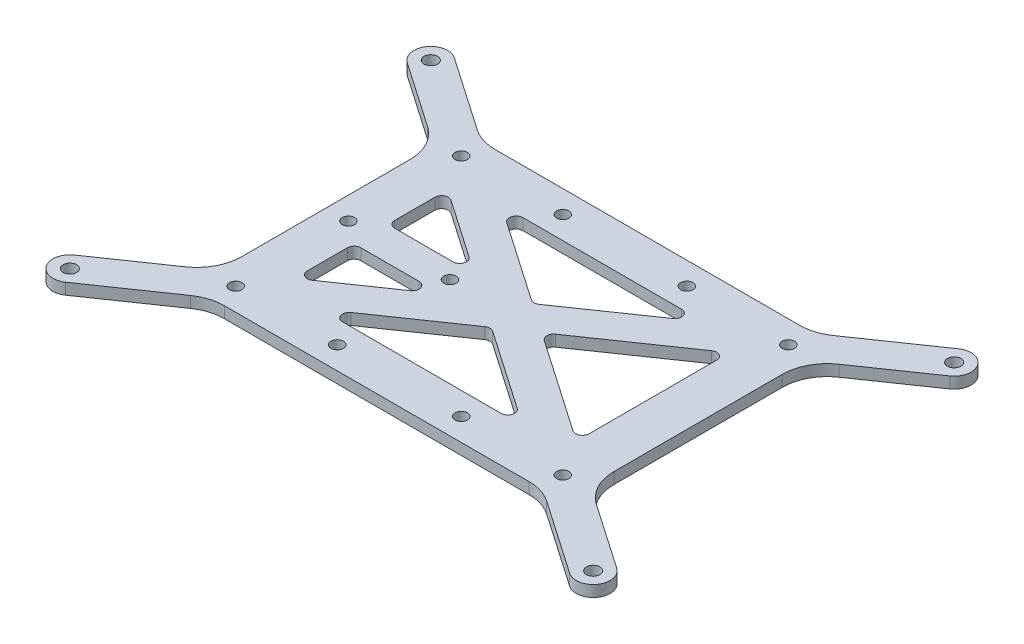
from build123d import *

# Parameters (mm, degrees)
BASE_FLANGE1_START     = -5
BASE_FLANGE1_OUTLINE_W = 165
BASE_FLANGE1_OUTLINE_H = 120
BASE_FLANGE1_DEPTH     = 5
SKETCH2_R              = 2.75
CUT_EXTRUDE1_DEPTH     = 5
CUT_EXTRUDE2_DEPTH     = 5
FILLET2_R              = 3
SKETCH4_R              = 3
TAB1_DEPTH             = 5
FILLET3_R              = 20


# Read off the part's stored shape, not the designer's step: Base-Flange1
# Sheet-metal steps are written as plain solids
with BuildPart() as part:
    # Base-Flange1 outline → Base-Flange1 (new body)
    with BuildSketch(Plane(origin=(0, 0, 0), x_dir=(1, 0, 0), z_dir=(0, 1, 0)).offset(BASE_FLANGE1_START)):
        Rectangle(BASE_FLANGE1_OUTLINE_W, BASE_FLANGE1_OUTLINE_H)
    extrude(amount=BASE_FLANGE1_DEPTH)

    # Sketch2 → Cut-Extrude1 (cut)
    with BuildSketch(Plane(origin=(0, 0, 0), x_dir=(1, 0, 0), z_dir=(0, 1, 0))):
        with Locations(Location((-72.5, 50, 0), (0, 0, 270))):
            Circle(SKETCH2_R)
        with Locations(Location((-72.5, 0, 0), (0, 0, 270))):
            Circle(SKETCH2_R)
        with Locations(Location((-72.5, -50, 0), (0, 0, 270))):
            Circle(SKETCH2_R)
        with Locations(Location((-27.5, -50, 0), (0, 0, 90))):
            Circle(SKETCH2_R)
        with Locations(Location((-27.5, 0, 0), (0, 0, 90))):
            Circle(SKETCH2_R)
        with Locations(Location((-27.5, 50, 0), (0, 0, 90))):
            Circle(SKETCH2_R)
        with Locations(Location((27.5, -50, 0), (0, 0, 270))):
            Circle(SKETCH2_R)
        with Locations(Location((72.5, -50, 0), (0, 0, 90))):
            Circle(SKETCH2_R)
        with Locations(Location((27.5, 50, 0), (0, 0, 270))):
            Circle(SKETCH2_R)
        with Locations(Location((72.5, 50, 0), (0, 0, 90))):
            Circle(SKETCH2_R)
    extrude(amount=-CUT_EXTRUDE1_DEPTH, mode=Mode.SUBTRACT)

    # Sketch3 → Cut-Extrude2 (cut)
    with BuildSketch(Plane(origin=(0, 0, 0), x_dir=(1, 0, 0), z_dir=(0, 1, 0))):
        Polygon((-62.5, -7.5), (-62.5, -33.99280261), (-24.085436215, -7.5), align=None)
        Polygon((-62.5, 7.5), (-24.085436215, 7.5), (-62.5, 33.99280261), align=None)
        Polygon((-44.789563785, 40), (0, 9.110645666), (44.789563785, 40), align=None)
        Polygon((62.5, 33.99280261), (13.210436215, 0), (62.5, -33.99280261), align=None)
        Polygon((-44.789563785, -40), (44.789563785, -40), (0, -9.110645666), align=None)
    extrude(amount=-CUT_EXTRUDE2_DEPTH, mode=Mode.SUBTRACT)

    # Fillet2
    fillet2_edges = [part.edges().sort_by_distance(p)[0] for p in [
        (13.210436215, -2.5, 0),
        (62.5, -2.5, -33.99280261),
        (62.5, -2.5, 33.99280261),
        (44.789563785, -2.5, 40),
        (-44.789563785, -2.5, 40),
        (0, -2.5, 9.110645666),
        (-62.5, -2.5, 33.99280261),
        (-62.5, -2.5, 7.5),
        (-24.085436215, -2.5, 7.5),
        (-24.085436215, -2.5, -7.5),
        (-62.5, -2.5, -7.5),
        (-62.5, -2.5, -33.99280261),
        (0, -2.5, -9.110645666),
        (-44.789563785, -2.5, -40),
        (44.789563785, -2.5, -40),
    ]]
    fillet(fillet2_edges, radius=FILLET2_R)

    # Sketch4 → Tab1 (add)
    # profile 1 of 4: a face of its own
    with BuildSketch(Plane(origin=(0, 0, 0), x_dir=(1, 0, 0), z_dir=(0, 1, 0))):
        with BuildLine():
            Line((-73.789563785, 60), (-111.742002831, 86.174095894))
            ThreePointArc((-111.742002831, 86.174095894), (-122.174095894, 84.257997169), (-120.257997169, 73.825904106))
            Line((-120.257997169, 73.825904106), (-82.5, 47.785906058))
            Line((-82.5, 47.785906058), (-73.789563785, 60))
        make_face()
        with Locations(Location((-116, 80, 0), (0, 0, 270))):
            Circle(SKETCH4_R, mode=Mode.SUBTRACT)
    # profile 2 of 4: a face of its own
    with BuildSketch(Plane(origin=(0, 0, 0), x_dir=(1, 0, 0), z_dir=(0, 1, 0))):
        with BuildLine():
            Line((73.789563785, 60), (82.5, 47.785906058))
            Line((82.5, 47.785906058), (120.257997169, 73.825904106))
            ThreePointArc((120.257997169, 73.825904106), (122.174095894, 84.257997169), (111.742002831, 86.174095894))
            Line((111.742002831, 86.174095894), (73.789563785, 60))
        make_face()
        with Locations(Location((116, 80, 0), (0, 0, 90))):
            Circle(SKETCH4_R, mode=Mode.SUBTRACT)
    # profile 3 of 4: a face of its own
    with BuildSketch(Plane(origin=(0, 0, 0), x_dir=(1, 0, 0), z_dir=(0, 1, 0))):
        with BuildLine():
            Line((73.789563785, -60), (111.742002831, -86.174095894))
            ThreePointArc((111.742002831, -86.174095894), (122.174095894, -84.257997169), (120.257997169, -73.825904106))
            Line((120.257997169, -73.825904106), (82.5, -47.785906058))
            Line((82.5, -47.785906058), (73.789563785, -60))
        make_face()
        with Locations(Location((116, -80, 0), (0, 0, 270))):
            Circle(SKETCH4_R, mode=Mode.SUBTRACT)
    # profile 4 of 4: a face of its own
    with BuildSketch(Plane(origin=(0, 0, 0), x_dir=(1, 0, 0), z_dir=(0, 1, 0))):
        with BuildLine():
            Line((-73.789563785, -60), (-82.5, -47.785906058))
            Line((-82.5, -47.785906058), (-120.257997169, -73.825904106))
            ThreePointArc((-120.257997169, -73.825904106), (-122.174095894, -84.257997169), (-111.742002831, -86.174095894))
            Line((-111.742002831, -86.174095894), (-73.789563785, -60))
        make_face()
        with Locations(Location((-116, -80, 0), (0, 0, 90))):
            Circle(SKETCH4_R, mode=Mode.SUBTRACT)
    extrude(amount=-TAB1_DEPTH)

    # Fillet3
    fillet3_edges = [part.edges().sort_by_distance(p)[0] for p in [
        (-73.789563785, -2.5, -60),
        (-82.5, -2.5, -47.785906058),
        (82.5, -2.5, -47.785906058),
        (73.789563785, -2.5, -60),
        (73.789563785, -2.5, 60),
        (82.5, -2.5, 47.785906058),
        (-82.5, -2.5, 47.785906058),
        (-73.789563785, -2.5, 60),
    ]]
    fillet(fillet3_edges, radius=FILLET3_R)


solid = part.part
